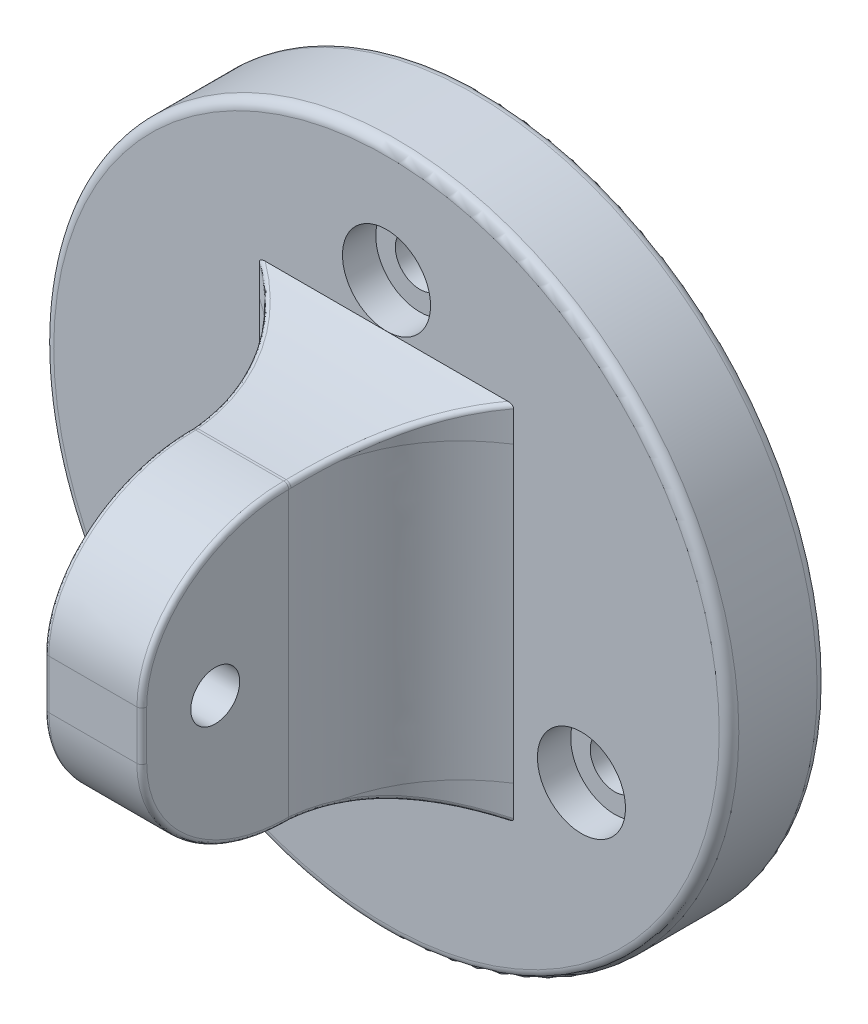
from build123d import *

# Parameters (mm, degrees)
SKIZZE1_R                            = 35
SKIZZE1_R_2                          = 2.5
AUFSATZ_LINEAR_AUSTRAGEN1_DEPTH      = 10
SKIZZE2_W                            = 10
SKIZZE2_H                            = 30
AUFSATZ_LINEAR_AUSTRAGEN2_DEPTH      = 30
AUFSATZ_LINEAR_AUSTRAGEN3_DEPTH      = 30
AUFSATZ_LINEAR_AUSTRAGEN5_DEPTH      = 13
AUFSATZ_LINEAR_AUSTRAGEN5_DEPTH_BACK = 13
SCHNITT_LINEAR_AUSTRAGEN2_DEPTH      = 15
SCHNITT_LINEAR_AUSTRAGEN3_DEPTH      = 15
SCHNITT_LINEAR_AUSTRAGEN4_DEPTH      = 15
SKIZZE11_R                           = 4.5
SCHNITT_LINEAR_AUSTRAGEN5_DEPTH      = 3.4
VERRUNDUNG4_SIZE                     = 15
VERRUNDUNG4_SIZE_2                   = 12.5
VERRUNDUNG5_R                        = 1
VERRUNDUNG7_R                        = 0.5
SKIZZE12_R                           = 2.5
SCHNITT_LINEAR_AUSTRAGEN6_DEPTH      = 30


with BuildPart() as part:
    # Skizze1 → Aufsatz-Linear austragen1 (new body)
    with BuildSketch(Plane.XY.offset(10)):
        with Locations((10, 10)):
            Circle(SKIZZE1_R)
        with Locations((10, 33)):
            Circle(SKIZZE1_R_2, mode=Mode.SUBTRACT)
        with Locations((29.918584287, -1.5)):
            Circle(SKIZZE1_R_2, mode=Mode.SUBTRACT)
        with Locations((-9.918584287, -1.5)):
            Circle(SKIZZE1_R_2, mode=Mode.SUBTRACT)
    extrude(amount=-AUFSATZ_LINEAR_AUSTRAGEN1_DEPTH)

    # Skizze2 → Aufsatz-Linear austragen2 (add)
    with BuildSketch(Plane.XY.offset(10)):
        with Locations((10, 10)):
            Rectangle(SKIZZE2_W, SKIZZE2_H)
    extrude(amount=AUFSATZ_LINEAR_AUSTRAGEN2_DEPTH)

    # Skizze4 → Aufsatz-Linear austragen3 (add)
    with BuildSketch(Plane(origin=(0, 25, 0), x_dir=(1, 0, 0), z_dir=(0, 1, 0))):
        with BuildLine():
            Line((5, -10), (5, -25))
            add(Edge.make_bspline(
                [(-3, -10), (4.708554491, -14.998874107), (5, -25)],
                knots=[0, 0, 0, 1, 1, 1], degree=2))
            Line((-3, -10), (5, -10))
        make_face()
        with BuildLine():
            Line((15, -10), (23, -10))
            add(Edge.make_bspline(
                [(23, -10), (15.291445509, -14.998874107), (15, -25)],
                knots=[0, 0, 0, 1, 1, 1], degree=2))
            Line((15, -25), (15, -10))
        make_face()
    extrude(amount=-AUFSATZ_LINEAR_AUSTRAGEN3_DEPTH)

    # Skizze5 → Aufsatz-Linear austragen5 (add, two sides: drawn at the far end of the back side and taken through both)
    with BuildSketch(Plane(origin=(10, 0, 0), x_dir=(0, 0, -1), z_dir=(1, 0, 0)).offset(-AUFSATZ_LINEAR_AUSTRAGEN5_DEPTH_BACK)):
        with BuildLine():
            Line((-9.987190603, -8.5), (-9.987190603, -5))
            Line((-9.987190603, -5), (-24.754842712, -5))
            add(Edge.make_bspline(
                [(-9.987190603, -8.5), (-17.014362487, -5.467352242), (-24.754842712, -5)],
                knots=[0, 0, 0, 1, 1, 1], degree=2))
        make_face()
        with BuildLine():
            Line((-24.754842712, 25), (-9.987190603, 25))
            Line((-9.987190603, 25), (-9.987190603, 28.5))
            add(Edge.make_bspline(
                [(-9.987190603, 28.5), (-17.014362487, 25.467352242), (-24.754842712, 25)],
                knots=[0, 0, 0, 1, 1, 1], degree=2))
        make_face()
    extrude(amount=AUFSATZ_LINEAR_AUSTRAGEN5_DEPTH + AUFSATZ_LINEAR_AUSTRAGEN5_DEPTH_BACK)

    # Skizze8 → Schnitt-Linear austragen2 (cut)
    with BuildSketch(Plane(origin=(0, -5, 0), x_dir=(1, 0, 0), z_dir=(0, 1, 0))):
        with BuildLine():
            Line((-3, -24.754842712), (4.99171268, -24.754842712))
            add(Edge.make_bspline(
                [(4.99171268, -24.754842712), (4.613783328, -14.937416518), (-3.000000013, -9.999999992)],
                knots=[0, 0, 0, 1, 1, 1], degree=2))
            Line((-3.000000013, -9.999999992), (-3, -24.754842712))
        make_face()
    extrude(amount=-SCHNITT_LINEAR_AUSTRAGEN2_DEPTH, mode=Mode.SUBTRACT)

    # Skizze9 → Schnitt-Linear austragen3 (cut)
    with BuildSketch(Plane(origin=(0, -5, 0), x_dir=(1, 0, 0), z_dir=(0, 1, 0))):
        with BuildLine():
            Line((23, -24.754842712), (23, -10))
            add(Edge.make_bspline(
                [(23, -10), (15.38621669, -14.937416514), (15.008287322, -24.754842665)],
                knots=[0, 0, 0, 1, 1, 1], degree=2))
            Line((15.008287322, -24.754842665), (23, -24.754842712))
        make_face()
    extrude(amount=-SCHNITT_LINEAR_AUSTRAGEN3_DEPTH, mode=Mode.SUBTRACT)

    # Skizze10 → Schnitt-Linear austragen4 (cut)
    with BuildSketch(Plane.XZ.offset(-25)):
        with BuildLine():
            Line((4.99171268, 24.754842712), (-3, 24.754842712))
            Line((-3, 24.754842712), (-3, 10))
            add(Edge.make_bspline(
                [(-3, 10), (4.613783328, 14.937416526), (4.99171268, 24.754842712)],
                knots=[0, 0, 0, 1, 1, 1], degree=2))
        make_face()
        with BuildLine():
            Line((23, 10), (23, 24.754842712))
            Line((23, 24.754842712), (15.00828732, 24.754842712))
            add(Edge.make_bspline(
                [(15.00828732, 24.754842712), (15.386216672, 14.937416526), (23, 10)],
                knots=[0, 0, 0, 1, 1, 1], degree=2))
        make_face()
    extrude(amount=-SCHNITT_LINEAR_AUSTRAGEN4_DEPTH, mode=Mode.SUBTRACT)

    # Skizze11 → Schnitt-Linear austragen5 (cut)
    with BuildSketch(Plane.XY.offset(10)):
        with Locations((-9.918584287, -1.5)):
            Circle(SKIZZE11_R)
        with Locations((29.918584287, -1.5)):
            Circle(SKIZZE11_R)
        with Locations((10, 33)):
            Circle(SKIZZE11_R)
    extrude(amount=-SCHNITT_LINEAR_AUSTRAGEN5_DEPTH, mode=Mode.SUBTRACT)

    # Verrundung4
    # an asymmetric fillet: 15, 12.5 mm, written as the material it takes off along each edge
    with BuildSketch(Plane(origin=(52.5, -5, 40), x_dir=(0, 0, -1), z_dir=(-1, 0, 0)), Plane(origin=(-32.5, 25, 40), x_dir=(0, 0, -1), z_dir=(1, 0, 0))) as verrundung4_piece_1:
        with BuildLine():
            Bezier((VERRUNDUNG4_SIZE, 0), (0, 0), (0, -VERRUNDUNG4_SIZE_2), weights=[1, 0.707106781, 1])
            Line((0, -VERRUNDUNG4_SIZE_2), (0, 0))
            Line((0, 0), (VERRUNDUNG4_SIZE, 0))
        make_face()
    extrude(amount=85, mode=Mode.SUBTRACT)

    # Verrundung5
    verrundung5_edges = [part.edges().sort_by_distance(p)[0] for p in [
        (-25, 10, 10),
        (-25, 10, 0),
    ]]
    fillet(verrundung5_edges, radius=VERRUNDUNG5_R)

    # Verrundung7
    verrundung7_edges = [part.edges().sort_by_distance(p)[0] for p in [
        (5, 21.727697526, 35.118469368),
        (5, 10, 40),
        (15, 21.727697526, 35.118469368),
        (15, 10, 40),
        (5, -1.727697526, 35.118469368),
        (15, -1.727697526, 35.118469368),
        (2.862805019, -6.33928236, 16.26544816),
        (17.137194977, -6.339282358, 16.265448167),
    ]]
    fillet(verrundung7_edges, radius=VERRUNDUNG7_R)

    # Skizze12 → Schnitt-Linear austragen6 (cut)
    with BuildSketch(Plane.ZY.offset(-5)):
        with Locations(Location((32.5, 10, 0), (0, 0, 270))):
            Circle(SKIZZE12_R)
    extrude(amount=-SCHNITT_LINEAR_AUSTRAGEN6_DEPTH, mode=Mode.SUBTRACT)


solid = part.part
